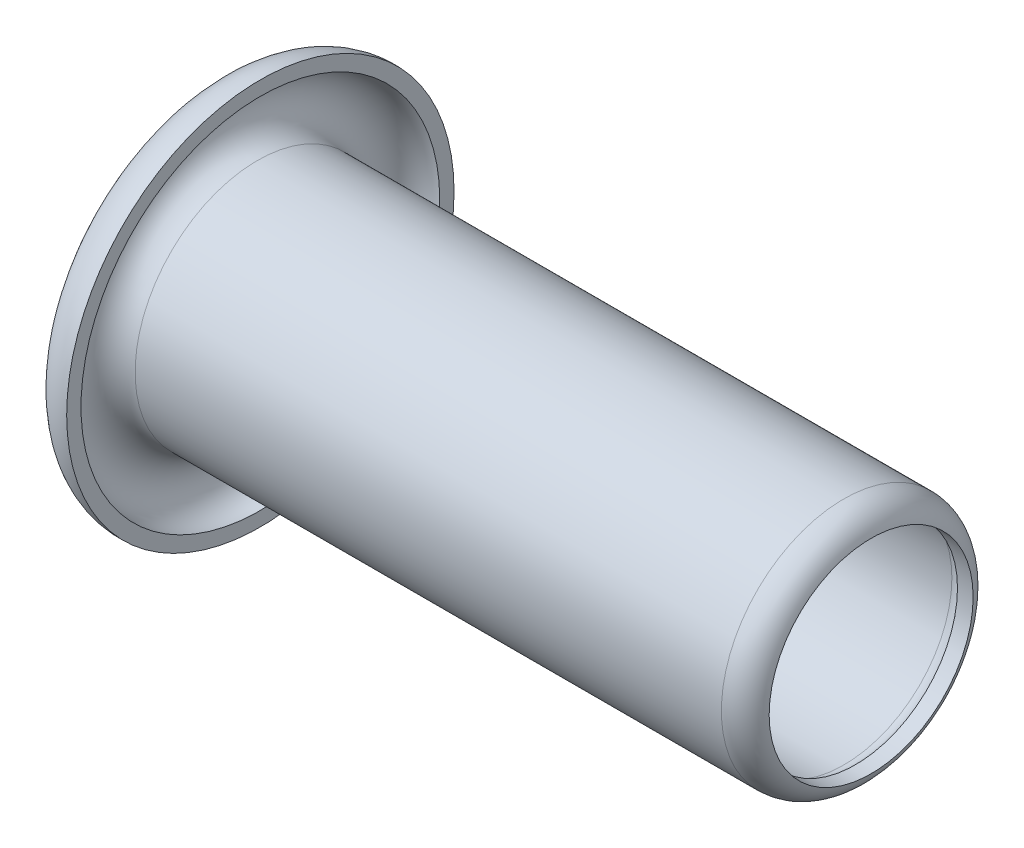
from build123d import *

# Parameters (mm, degrees)
SKETCH2_W = 1.7
SKETCH2_H = 2.5


with BuildPart() as part:
    # Sketch1 → Base-Revolve (revolve)
    with BuildSketch(Plane(origin=(2.098205081, 0.901794919, 0), x_dir=(0, 1, 0), z_dir=(0, 0, 1))):
        with BuildLine():
            Line((3.494696287, 0.978205081), (3.845869149, 0.978205081))
            ThreePointArc((3.845869149, 0.978205081), (2.833224563, 2.097620935), (1.748205081, 1.048205081))
            Line((1.748205081, 1.048205081), (1.748205081, -13.321794919))
            ThreePointArc((1.748205081, -13.321794919), (1.645692454, -13.569282293), (1.398205081, -13.671794919))
            Line((1.398205081, -13.671794919), (-0.901794919, -13.671794919))
            Line((-0.901794919, -13.671794919), (-0.901794919, -14.021794919))
            Line((-0.901794919, -14.021794919), (1.398205081, -14.021794919))
            ThreePointArc((1.398205081, -14.021794919), (1.893179828, -13.816769666), (2.098205081, -13.321794919))
            Line((2.098205081, -13.321794919), (2.098205081, 1.048205081))
            ThreePointArc((2.098205081, 1.048205081), (2.833249023, 1.747327332), (3.494696287, 0.978205081))
        make_face()
    revolve(axis=Axis((16.12, 0, 0), (-1, 0, 0)))

    # Sketch2 → Cut-Revolve1 (revolve, cut)
    with BuildSketch(Plane.XY):
        with Locations((15.77, 1.25)):
            Rectangle(SKETCH2_W, SKETCH2_H)
    revolve(axis=Axis((0, 0, 0), (1, 0, 0)), mode=Mode.SUBTRACT)


solid = part.part
